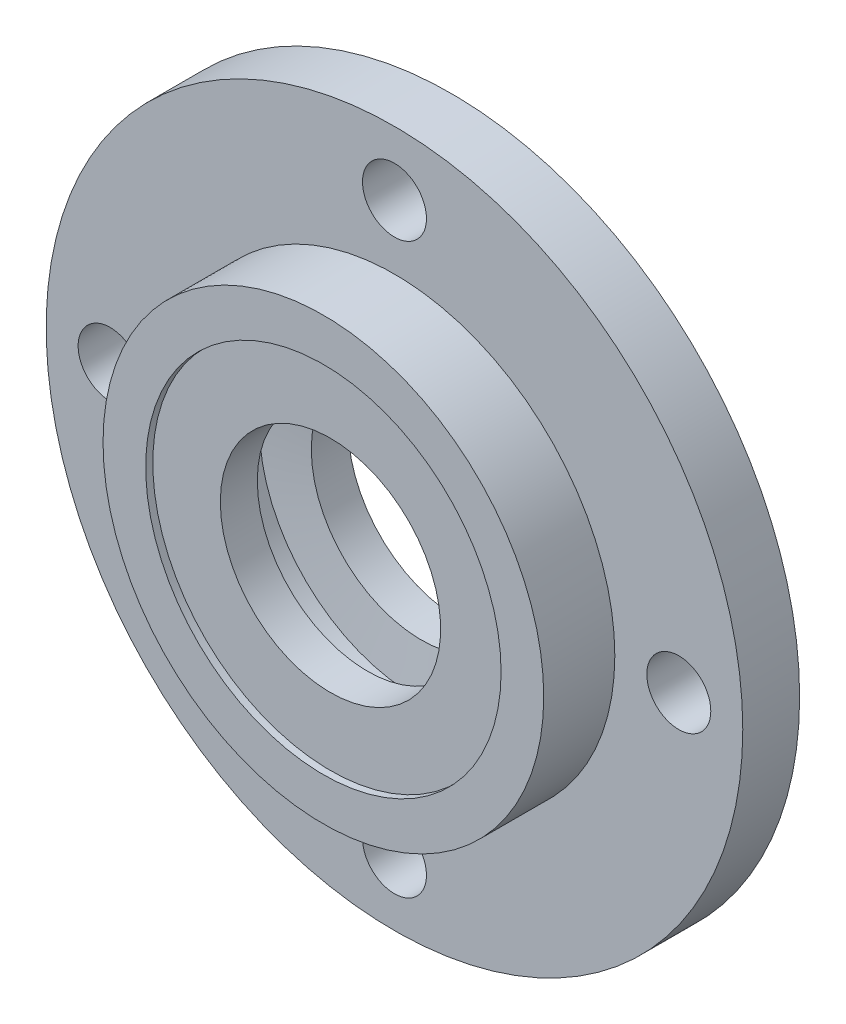
from build123d import *

# Parameters (mm, degrees)
SKETCH_1_R          = 30
EXTRUDE_1_DEPTH     = 1
SKETCH_2_R          = 49
EXTRUDE_2_DEPTH     = 8
SKETCH_3_R          = 31
EXTRUDE_3_DEPTH     = 10
SKETCH_4_R          = 25
CUT_EXTRUDE_1_DEPTH = 1
SKETCH_5_R          = 15.5
CUT_EXTRUDE_2_DEPTH = 6
SKETCH_6_R          = 22
CUT_EXTRUDE_3_DEPTH = 6
SKETCH_7_R          = 15.5
CUT_EXTRUDE_4_DEPTH = 6
CHAMFER_1_SIZE2     = 6.5
CHAMFER_1_SIZE      = 0.798099646
CHAMFER_2_SIZE2     = 0.798099646
CHAMFER_2_SIZE      = 6.5
SKETCH_8_R          = 4.5
CUT_EXTRUDE_5_DEPTH = 10


with BuildPart() as part:
    # 草图1 → 凸台-拉伸1 (new body)
    with BuildSketch(Plane.XY):
        Circle(SKETCH_1_R)
    extrude(amount=EXTRUDE_1_DEPTH)

    # 草图2 → 凸台-拉伸2 (add)
    with BuildSketch(Plane.XY.offset(1)):
        Circle(SKETCH_2_R)
    extrude(amount=EXTRUDE_2_DEPTH)

    # 草图3 → 凸台-拉伸3 (add)
    with BuildSketch(Plane.XY.offset(9)):
        Circle(SKETCH_3_R)
    extrude(amount=EXTRUDE_3_DEPTH)

    # 草图4 → 切除-拉伸1 (cut)
    with BuildSketch(Plane.XY.offset(19)):
        Circle(SKETCH_4_R)
    extrude(amount=-CUT_EXTRUDE_1_DEPTH, mode=Mode.SUBTRACT)

    # 草图5 → 切除-拉伸2 (cut)
    with BuildSketch(Plane(origin=(0, 0, 0), x_dir=(-1, 0, 0), z_dir=(0, 0, -1))):
        Circle(SKETCH_5_R)
    extrude(amount=-CUT_EXTRUDE_2_DEPTH, mode=Mode.SUBTRACT)

    # 草图6 → 切除-拉伸3 (cut)
    with BuildSketch(Plane(origin=(0, 0, 6), x_dir=(-1, 0, 0), z_dir=(0, 0, -1))):
        Circle(SKETCH_6_R)
    extrude(amount=-CUT_EXTRUDE_3_DEPTH, mode=Mode.SUBTRACT)

    # 草图7 → 切除-拉伸4 (cut)
    with BuildSketch(Plane(origin=(0, 0, 12), x_dir=(-1, 0, 0), z_dir=(0, 0, -1))):
        Circle(SKETCH_7_R)
    extrude(amount=-CUT_EXTRUDE_4_DEPTH, mode=Mode.SUBTRACT)

    # 倒角1
    chamfer_1_edges = [part.edges().sort_by_distance(p)[0] for p in [
        (15.5, 0, 6),
    ]]
    chamfer_1_side = [part.faces().sort_by_distance(p)[0] for p in [
        (15.5, 0, 5.984038007),
    ]]
    chamfer(chamfer_1_edges, length=CHAMFER_1_SIZE - 0.0001, length2=CHAMFER_1_SIZE2 - 0.0001, reference=chamfer_1_side[0])  # a hair under: the kernel refuses the full size

    # 倒角2
    chamfer_2_edges = [part.edges().sort_by_distance(p)[0] for p in [
        (15.5, 0, 12),
    ]]
    chamfer_2_side = [part.faces().sort_by_distance(p)[0] for p in [
        (15.515961993, 0, 12),
    ]]
    chamfer(chamfer_2_edges, length=CHAMFER_2_SIZE - 0.0001, length2=CHAMFER_2_SIZE2 - 0.0001, reference=chamfer_2_side[0])  # a hair under: the kernel refuses the full size

    # 草图8 → 切除-拉伸5 (cut)
    with BuildSketch(Plane.XY.offset(9)):
        with Locations((0, 40)):
            Circle(SKETCH_8_R)
        with Locations((40, 0)):
            Circle(SKETCH_8_R)
        with Locations((0, -40)):
            Circle(SKETCH_8_R)
        with Locations((-40, 0)):
            Circle(SKETCH_8_R)
    extrude(amount=-CUT_EXTRUDE_5_DEPTH, mode=Mode.SUBTRACT)


solid = part.part
